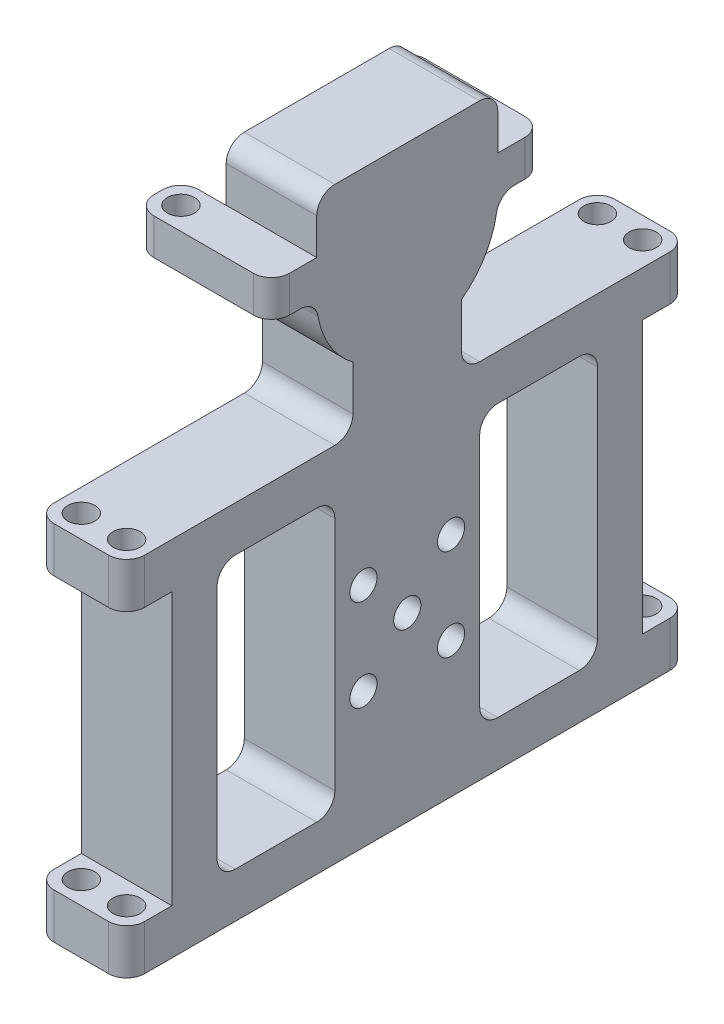
from build123d import *
from build123d.topology import SkipClean

# Parameters (mm, degrees)
SKETCH1_W            = 90
SKETCH1_H            = 20
BOSS_EXTRUDE1_DEPTH  = 20
SKETCH2_W            = 90
SKETCH2_H            = 3
CUT_EXTRUDE1_DEPTH   = 10
SKETCH3_W            = 3
SKETCH3_H            = 5
CUT_EXTRUDE2_DEPTH   = 10
SKETCH4_W            = 3
SKETCH4_H            = 1.75
SKETCH4_W_2          = 2.997618753
SKETCH4_W_3          = 3.002941468
CUT_EXTRUDE3_DEPTH   = 5
SKETCH5_W            = 1.5
SKETCH5_H            = 3
BOSS_EXTRUDE2_DEPTH  = 10
SKETCH6_W            = 1.5
SKETCH6_H            = 3
BOSS_EXTRUDE3_DEPTH  = 18
BOSS_EXTRUDE4_DEPTH  = 5
FILLET1_START        = 8.5
FILLET1_DEPTH        = 3
FILLET1_START_2      = 8
FILLET1_2_DEPTH      = 4
FILLET2_R            = 10
SKETCH8_W            = 20.140972823
SKETCH8_H            = 2
CUT_EXTRUDE4_DEPTH   = 119
FILLET3_R            = 2
SKETCH9_W            = 5
SKETCH9_H            = 4
BOSS_EXTRUDE6_DEPTH  = 5
SKETCH11_W           = 5
SKETCH11_H           = 4
BOSS_EXTRUDE7_DEPTH  = 5
SKETCH12_R           = 1.5
CUT_EXTRUDE5_DEPTH   = 24
FILLET4_R            = 2
SKETCH14_W           = 71.95999564
SKETCH14_H           = 44.647918029
CUT_EXTRUDE8_DEPTH   = 55
BOSS_EXTRUDE8_START  = 1.5
BOSS_EXTRUDE8_DEPTH  = 1.5
SKETCH16_W           = 5.976122604
SKETCH16_H           = 3
CUT_EXTRUDE9_DEPTH   = 10
SKETCH17_W           = 2
SKETCH17_H           = 3
BOSS_EXTRUDE9_DEPTH  = 10
BOSS_EXTRUDE10_DEPTH = 5
BOSS_EXTRUDE11_DEPTH = 10
SKETCH21_W           = 10
SKETCH21_H           = 4
BOSS_EXTRUDE21_DEPTH = 5
SKETCH22_R           = 1.5
CUT_EXTRUDE10_DEPTH  = 5
SKETCH23_W           = 10
SKETCH23_H           = 4
BOSS_EXTRUDE22_DEPTH = 5
SKETCH24_R           = 1.5
CUT_EXTRUDE11_DEPTH  = 5
SKETCH25_W           = 46.117576458
SKETCH25_H           = 7.536313902
CUT_EXTRUDE12_DEPTH  = 49
SKETCH26_W           = 45
SKETCH26_H           = 20
CUT_EXTRUDE13_DEPTH  = 49
SKETCH27_W           = 5
SKETCH27_H           = 4
BOSS_EXTRUDE23_DEPTH = 10
SKETCH28_R           = 1.5
CUT_EXTRUDE14_DEPTH  = 10
SKETCH29_W           = 5
SKETCH29_H           = 0.02
CUT_EXTRUDE15_DEPTH  = 10
FILLET8_R            = 2
SKETCH30_W           = 3
SKETCH30_H           = 12
CUT_EXTRUDE16_DEPTH  = 15
FILLET10_R           = 2
SKETCH32_R           = 1.5
CUT_EXTRUDE17_DEPTH  = 7.5
FILLET11_START       = -10
FILLET11_DEPTH       = 10
FILLET11_START_2     = -10.30822
FILLET11_2_DEPTH     = 10.61644
FILLET11_START_3     = -14.991159554
FILLET11_3_DEPTH     = 19.982319108
FILLET11_START_4     = -11.666666667
FILLET11_4_OUTLINE_R = 1.5
FILLET11_4_DEPTH     = 1.666666667
CUT_EXTRUDE19_DEPTH  = 32
SKETCH35_W           = 10
SKETCH35_H           = 12
BOSS_EXTRUDE24_DEPTH = 10
SKETCH36_W           = 10
SKETCH36_H           = 12
BOSS_EXTRUDE25_DEPTH = 16
SKETCH37_W           = 8.422588627
SKETCH37_H           = 30.638855418
CUT_EXTRUDE20_DEPTH  = 16
FILLET12_R           = 2
SKETCH38_W           = 10
SKETCH38_H           = 12
BOSS_EXTRUDE26_DEPTH = 47
SKETCH39_W           = 10
SKETCH39_H           = 5
BOSS_EXTRUDE27_DEPTH = 20
SKETCH41_W           = 5
SKETCH41_H           = 30.04
SKETCH41_W_2         = 15
SKETCH41_H_2         = 5
BOSS_EXTRUDE28_DEPTH = 10
SKETCH42_W           = 10
SKETCH42_H           = 5
BOSS_EXTRUDE29_DEPTH = 5
SKETCH43_W           = 10
SKETCH43_H           = 5
BOSS_EXTRUDE30_DEPTH = 5
SKETCH44_R           = 1.5
CUT_EXTRUDE21_DEPTH  = 48
FILLET13_R           = 2
SKETCH45_W           = 16
SKETCH45_H           = 30.04
BOSS_EXTRUDE31_DEPTH = 10
SKETCH46_R           = 1.5
CUT_EXTRUDE22_DEPTH  = 10
FILLET14_R           = 2


with BuildPart() as part:
    # Sketch1 → Boss-Extrude1 (new body)
    with BuildSketch(Plane.XY):
        with Locations((45, -10)):
            Rectangle(SKETCH1_W, SKETCH1_H)
    extrude(amount=BOSS_EXTRUDE1_DEPTH)

    # Sketch2 → Cut-Extrude1 (cut)
    with BuildSketch(Plane(origin=(0, 0, 0), x_dir=(1, 0, 0), z_dir=(0, 1, 0))):
        with Locations((45, -10)):
            Rectangle(SKETCH2_W, SKETCH2_H)
    extrude(amount=-CUT_EXTRUDE1_DEPTH, mode=Mode.SUBTRACT)

    # Sketch3 → Cut-Extrude2 (cut)
    with BuildSketch(Plane(origin=(0, 0, 0), x_dir=(1, 0, 0), z_dir=(0, 1, 0))):
        with Locations((11.25, -15.75)):
            Rectangle(SKETCH3_W, SKETCH3_H)
        with Locations((22.5, -15.75)):
            Rectangle(SKETCH3_W, SKETCH3_H)
        with Locations((33.75, -15.75)):
            Rectangle(SKETCH3_W, SKETCH3_H)
        with Locations((45, -15.75)):
            Rectangle(SKETCH3_W, SKETCH3_H)
        with Locations((56.25, -15.75)):
            Rectangle(SKETCH3_W, SKETCH3_H)
        with Locations((67.5, -15.75)):
            Rectangle(SKETCH3_W, SKETCH3_H)
        with Locations((78.75, -15.75)):
            Rectangle(SKETCH3_W, SKETCH3_H)
        with Locations((11.25, -4.25)):
            Rectangle(SKETCH3_W, SKETCH3_H)
        with Locations((22.5, -4.25)):
            Rectangle(SKETCH3_W, SKETCH3_H)
        with Locations((33.75, -4.25)):
            Rectangle(SKETCH3_W, SKETCH3_H)
        with Locations((45, -4.25)):
            Rectangle(SKETCH3_W, SKETCH3_H)
        with Locations((56.25, -4.25)):
            Rectangle(SKETCH3_W, SKETCH3_H)
        with Locations((67.5, -4.25)):
            Rectangle(SKETCH3_W, SKETCH3_H)
        with Locations((78.75, -4.25)):
            Rectangle(SKETCH3_W, SKETCH3_H)
    extrude(amount=-CUT_EXTRUDE2_DEPTH, mode=Mode.SUBTRACT)

    # Sketch4 → Cut-Extrude3 (cut)
    with BuildSketch(Plane(origin=(0, 0, 0), x_dir=(1, 0, 0), z_dir=(0, 1, 0))):
        with Locations((56.25, -19.125)):
            Rectangle(SKETCH4_W, SKETCH4_H)
        with Locations((67.5, -19.125)):
            Rectangle(SKETCH4_W, SKETCH4_H)
        Polygon((77.25, -18.25), (77.25, -20), (80.252941468, -20), (80.252941468, -18.25), (80.25, -18.25), align=None)
        with Locations((45, -19.125)):
            Rectangle(SKETCH4_W, SKETCH4_H)
        with Locations((33.748809377, -19.125)):
            Rectangle(SKETCH4_W_2, SKETCH4_H)
        with Locations((22.5, -19.125)):
            Rectangle(SKETCH4_W, SKETCH4_H)
        with Locations((11.25, -19.125)):
            Rectangle(SKETCH4_W, SKETCH4_H)
        with Locations((22.5, -0.875)):
            Rectangle(SKETCH4_W, SKETCH4_H)
        with Locations((33.748809377, -0.875)):
            Rectangle(SKETCH4_W_2, SKETCH4_H)
        with Locations((45, -0.875)):
            Rectangle(SKETCH4_W, SKETCH4_H)
        with Locations((56.25, -0.875)):
            Rectangle(SKETCH4_W, SKETCH4_H)
        with Locations((67.5, -0.875)):
            Rectangle(SKETCH4_W, SKETCH4_H)
        with Locations((78.751470734, -0.875)):
            Rectangle(SKETCH4_W_3, SKETCH4_H)
        with Locations((11.25, -0.875)):
            Rectangle(SKETCH4_W, SKETCH4_H)
    extrude(amount=-CUT_EXTRUDE3_DEPTH, mode=Mode.SUBTRACT)

    # Sketch5 → Boss-Extrude2 (add)
    with BuildSketch(Plane(origin=(0, -10, 0), x_dir=(1, 0, 0), z_dir=(0, 1, 0))):
        with Locations((0.75, -10)):
            Rectangle(SKETCH5_W, SKETCH5_H)
        with Locations((89.25, -10)):
            Rectangle(SKETCH5_W, SKETCH5_H)
    extrude(amount=BOSS_EXTRUDE2_DEPTH)

    # Sketch6 → Boss-Extrude3 (add)
    with BuildSketch(Plane(origin=(0, 0, 0), x_dir=(1, 0, 0), z_dir=(0, 1, 0))):
        with Locations((2.25, -10)):
            Rectangle(SKETCH6_W, SKETCH6_H)
        with Locations((87.75, -10)):
            Rectangle(SKETCH6_W, SKETCH6_H)
    extrude(amount=-BOSS_EXTRUDE3_DEPTH)

    # Sketch7 → Boss-Extrude4 (add)
    with BuildSketch(Plane.XY.offset(8.5)):
        Polygon((3, -9.907661673), (3, -10), (6, -10), (3, 0), align=None)
        Polygon((87, 0), (84, -10), (87, -10), align=None)
    extrude(amount=BOSS_EXTRUDE4_DEPTH)

    # Fillet1: read off the stored shape, not the designer's step
    # Fillet1 outline → Fillet1 (cut)
    with BuildSketch(Plane.XY.offset(FILLET1_START)):
        with BuildLine():
            ThreePointArc((1.511938698, 0), (2.705799758, -0.395414143), (3.427591269, -1.425304229))
            Line((3.427591269, -1.425304229), (3, 0))
            Line((3, 0), (1.511938698, 0))
        make_face()
        with BuildLine():
            Line((87, 0), (86.572408731, -1.425304229))
            ThreePointArc((86.572408731, -1.425304229), (87.294200242, -0.395414143), (88.488061302, 0))
            Line((88.488061302, 0), (87, 0))
        make_face()
    extrude(amount=FILLET1_DEPTH, mode=Mode.SUBTRACT)

    # Fillet1 2 outline → Fillet1 2 (add)
    with BuildSketch(Plane.XY.offset(FILLET1_START_2)):
        with BuildLine():
            Line((6, -10), (7.488061302, -10))
            ThreePointArc((7.488061302, -10), (6.294200242, -9.604585857), (5.572408731, -8.574695771))
            Line((5.572408731, -8.574695771), (6, -10))
        make_face()
        with BuildLine():
            ThreePointArc((84.427591269, -8.574695771), (83.705799758, -9.604585857), (82.511938698, -10))
            Line((82.511938698, -10), (84, -10))
            Line((84, -10), (84.427591269, -8.574695771))
        make_face()
    extrude(amount=FILLET1_2_DEPTH)

    # Fillet2
    fillet2_edges = [part.edges().sort_by_distance(p)[0] for p in [
        (45, -20, 0),
        (45, -20, 20),
    ]]
    fillet(fillet2_edges, radius=FILLET2_R - 0.0001)  # a hair under: the kernel refuses the full size

    # Sketch8 → Cut-Extrude4 (cut)
    with BuildSketch(Plane.ZY):
        with Locations((10.770725067, -19)):
            Rectangle(SKETCH8_W, SKETCH8_H)
    extrude(amount=-CUT_EXTRUDE4_DEPTH, mode=Mode.SUBTRACT)

    # Fillet3
    fillet3_edges = [part.edges().sort_by_distance(p)[0] for p in [
        (4.875, 0, 0),
        (4.875, 0, 20),
        (16.875, 0, 20),
        (16.875, 0, 0),
        (28.125, 0, 0),
        (28.125, 0, 20),
        (39.373809377, 0, 20),
        (39.373809377, 0, 0),
        (50.625, 0, 0),
        (50.625, 0, 20),
        (61.875, 0, 20),
        (61.875, 0, 0),
        (73.125, 0, 0),
        (73.125, 0, 20),
        (85.126470734, 0, 20),
        (85.126470734, 0, 0),
    ]]
    fillet(fillet3_edges, radius=FILLET3_R)

    # Sketch9 → Boss-Extrude6 (add)
    with BuildSketch(Plane.ZY):
        with Locations((-2.5, -4)):
            Rectangle(SKETCH9_W, SKETCH9_H)
        with Locations((22.5, -4)):
            Rectangle(SKETCH9_W, SKETCH9_H)
    extrude(amount=-BOSS_EXTRUDE6_DEPTH)

    # Sketch11 → Boss-Extrude7 (add)
    with BuildSketch(Plane(origin=(90, 0, 0), x_dir=(0, 0, -1), z_dir=(1, 0, 0))):
        with Locations((2.5, -4)):
            Rectangle(SKETCH11_W, SKETCH11_H)
        with Locations((-22.5, -4)):
            Rectangle(SKETCH11_W, SKETCH11_H)
    extrude(amount=-BOSS_EXTRUDE7_DEPTH)

    # Sketch12 → Cut-Extrude5 (cut)
    with BuildSketch(Plane(origin=(0, -2, 0), x_dir=(1, 0, 0), z_dir=(0, 1, 0))):
        with Locations(Location((2.5, 2.5, 0), (0, 0, 180))):
            Circle(SKETCH12_R)
        with Locations(Location((87.5, 2.5, 0), (0, 0, 180))):
            Circle(SKETCH12_R)
        with Locations(Location((87.5, -22.5, 0), (0, 0, 180))):
            Circle(SKETCH12_R)
        with Locations(Location((2.5, -22.5, 0), (0, 0, 180))):
            Circle(SKETCH12_R)
    extrude(amount=-CUT_EXTRUDE5_DEPTH, mode=Mode.SUBTRACT)

    # Fillet4
    fillet4_edges = [part.edges().sort_by_distance(p)[0] for p in [
        (0, -4, -5),
        (5, -4, -5),
        (5, -4, 25),
        (0, -4, 25),
        (85, -4, -5),
        (90, -4, -5),
        (85, -4, 25),
        (90, -4, 25),
    ]]
    fillet(fillet4_edges, radius=FILLET4_R)

    # Sketch14 → Cut-Extrude8 (cut)
    with BuildSketch(Plane(origin=(0, 0, 0), x_dir=(1, 0, 0), z_dir=(0, 1, 0))):
        with Locations((79.47999782, -11.65925291)):
            Rectangle(SKETCH14_W, SKETCH14_H)
    extrude(amount=-CUT_EXTRUDE8_DEPTH, mode=Mode.SUBTRACT)

    # Sketch15 → Boss-Extrude8 (add)
    with BuildSketch(Plane(origin=(43.5, 0, 0), x_dir=(0, 0, -1), z_dir=(1, 0, 0)).offset(BOSS_EXTRUDE8_START)):
        with BuildLine():
            Line((-11.5, 0), (-18, 0))
            ThreePointArc((-18, 0), (-19.414213562, -0.585786438), (-20, -2))
            Line((-20, -2), (-20, -10))
            ThreePointArc((-20, -10), (-18.94427191, -14.472135955), (-16, -18))
            Line((-16, -18), (-4, -18))
            ThreePointArc((-4, -18), (-1.05572809, -14.472135955), (0, -10))
            Line((0, -10), (0, -2))
            ThreePointArc((0, -2), (-0.585786438, -0.585786438), (-2, 0))
            Line((-2, 0), (-4, 0))
            Line((-4, 0), (-8.5, 0))
            Line((-8.5, 0), (-8.5, -10))
            Line((-8.5, -10), (-11.5, -10))
            Line((-11.5, -10), (-11.5, 0))
        make_face()
    extrude(amount=-BOSS_EXTRUDE8_DEPTH)

    # Sketch16 → Cut-Extrude9 (cut)
    with BuildSketch(Plane(origin=(0, 0, 0), x_dir=(1, 0, 0), z_dir=(0, 1, 0))):
        with Locations((4.5, -10)):
            Rectangle(SKETCH16_W, SKETCH16_H)
    extrude(amount=-CUT_EXTRUDE9_DEPTH, mode=Mode.SUBTRACT)

    # Sketch17 → Boss-Extrude9 (add)
    with BuildSketch(Plane(origin=(0, 0, 0), x_dir=(1, 0, 0), z_dir=(0, 1, 0))):
        Polygon((2, -8.5), (1.511938698, -8.5), (0, -8.5), (0, -11.5), (1.511938698, -11.5), (2, -11.5), align=None)
        with Locations((44, -10)):
            Rectangle(SKETCH17_W, SKETCH17_H)
    extrude(amount=-BOSS_EXTRUDE9_DEPTH)

    # Sketch18 → Boss-Extrude10 (add)
    with BuildSketch(Plane.XY.offset(8.5)):
        Polygon((4, -10), (2, 0), (2, -10), align=None)
        Polygon((43, 0), (41, -10), (43, -10), align=None)
    extrude(amount=BOSS_EXTRUDE10_DEPTH)

    # Sketch19 → Boss-Extrude11 (add)
    with BuildSketch(Plane.ZY):
        with BuildLine():
            ThreePointArc((2, 0), (0.585786438, -0.585786438), (0, -2))
            Line((0, -2), (0, -6))
            Line((0, -6), (0, -10))
            ThreePointArc((0, -10), (1.05572809, -14.472135955), (4, -18))
            Line((4, -18), (16, -18))
            ThreePointArc((16, -18), (18.94427191, -14.472135955), (20, -10))
            Line((20, -10), (20, -6))
            Line((20, -6), (20, -2))
            ThreePointArc((20, -2), (19.414213562, -0.585786438), (18, 0))
            Line((18, 0), (16, 0))
            Line((16, 0), (2, 0))
        make_face()
    extrude(amount=BOSS_EXTRUDE11_DEPTH)

    # Sketch21 → Boss-Extrude21 (add)
    with BuildSketch(Plane.XY.offset(20)):
        with Locations((0, -8)):
            Rectangle(SKETCH21_W, SKETCH21_H)
    extrude(amount=BOSS_EXTRUDE21_DEPTH)

    # Sketch22 → Cut-Extrude10 (cut)
    with BuildSketch(Plane(origin=(0, -6, 0), x_dir=(1, 0, 0), z_dir=(0, 1, 0))):
        with Locations(Location((2.5, -22.5, 0), (0, 0, 180))):
            Circle(SKETCH22_R)
    extrude(amount=-CUT_EXTRUDE10_DEPTH, mode=Mode.SUBTRACT)

    # Sketch23 → Boss-Extrude22 (add)
    with BuildSketch(Plane(origin=(0, 0, 0), x_dir=(-1, 0, 0), z_dir=(0, 0, -1))):
        with Locations((0, -8)):
            Rectangle(SKETCH23_W, SKETCH23_H)
    extrude(amount=BOSS_EXTRUDE22_DEPTH)

    # Sketch24 → Cut-Extrude11 (cut)
    with BuildSketch(Plane(origin=(0, -6, 0), x_dir=(1, 0, 0), z_dir=(0, 1, 0))):
        with Locations(Location((2.5, 2.5, 0), (0, 0, 180))):
            Circle(SKETCH24_R)
    extrude(amount=-CUT_EXTRUDE11_DEPTH, mode=Mode.SUBTRACT)

    # Sketch25 → Cut-Extrude12 (cut)
    with BuildSketch(Plane.XY.offset(25)):
        with Locations((23.058788229, -2.231843049)):
            Rectangle(SKETCH25_W, SKETCH25_H)
    extrude(amount=-CUT_EXTRUDE12_DEPTH, mode=Mode.SUBTRACT)

    # Sketch26 → Cut-Extrude13 (cut)
    with BuildSketch(Plane(origin=(0, -6, 0), x_dir=(1, 0, 0), z_dir=(0, 1, 0))):
        with Locations((22.5, -10)):
            Rectangle(SKETCH26_W, SKETCH26_H)
    extrude(amount=-CUT_EXTRUDE13_DEPTH, mode=Mode.SUBTRACT)

    # Sketch27 → Boss-Extrude23 (add)
    with BuildSketch(Plane.ZY.offset(5)):
        with Locations((-2.5, -8)):
            Rectangle(SKETCH27_W, SKETCH27_H)
        with Locations((22.5, -8)):
            Rectangle(SKETCH27_W, SKETCH27_H)
    extrude(amount=BOSS_EXTRUDE23_DEPTH)

    # Sketch28 → Cut-Extrude14 (cut)
    with BuildSketch(Plane(origin=(0, -6, 0), x_dir=(1, 0, 0), z_dir=(0, 1, 0))):
        with Locations(Location((-12.5, 2.5, 0), (0, 0, 270))):
            Circle(SKETCH28_R)
        with Locations(Location((-12.5, -22.5, 0), (0, 0, 270))):
            Circle(SKETCH28_R)
    extrude(amount=-CUT_EXTRUDE14_DEPTH, mode=Mode.SUBTRACT)

    # Sketch29 → Cut-Extrude15 (cut)
    with BuildSketch(Plane(origin=(0, -6, 0), x_dir=(1, 0, 0), z_dir=(0, 1, 0))):
        with Locations((-12.5, 0.01)):
            Rectangle(SKETCH29_W, SKETCH29_H)
        with Locations((2.5, 0.01)):
            Rectangle(SKETCH29_W, SKETCH29_H)
        with Locations((-12.5, -20.01)):
            Rectangle(SKETCH29_W, SKETCH29_H)
        with Locations((2.5, -20.01)):
            Rectangle(SKETCH29_W, SKETCH29_H)
    extrude(amount=-CUT_EXTRUDE15_DEPTH, mode=Mode.SUBTRACT)

    # Fillet8
    fillet8_edges = [part.edges().sort_by_distance(p)[0] for p in [
        (5, -8, 25),
        (5, -8, -5),
        (-15, -8, -5),
        (-15, -8, 25),
        (-15, -8, 20.02),
        (-15, -8, -0.02),
        (5, -8, -0.02),
        (5, -8, 20.02),
    ]]
    fillet(fillet8_edges, radius=FILLET8_R)

    # Sketch30 → Cut-Extrude16 (cut)
    with BuildSketch(Plane.XZ.offset(18)):
        with Locations((-5, 10)):
            Rectangle(SKETCH30_W, SKETCH30_H)
    extrude(amount=-CUT_EXTRUDE16_DEPTH, mode=Mode.SUBTRACT)

    # Fillet10
    fillet10_edges = [part.edges().sort_by_distance(p)[0] for p in [
        (-5, -3, 4),
        (-5, -3, 16),
    ]]
    fillet(fillet10_edges, radius=FILLET10_R)

    # Sketch32 → Cut-Extrude17 (cut, symmetric)
    with BuildSketch(Plane(origin=(-6.5, 0, 0), x_dir=(0, 0, -1), z_dir=(1, 0, 0))):
        with Locations(Location((-7, -10.5, 0), (0, 0, 270))):
            Circle(SKETCH32_R)
        with Locations(Location((-13, -10.5, 0), (0, 0, 270))):
            Circle(SKETCH32_R)
    extrude(amount=CUT_EXTRUDE17_DEPTH, both=True, mode=Mode.SUBTRACT)

    # Fillet11: read off the stored shape, not the designer's step
    # Fillet11 outline → Fillet11 (add)
    with BuildSketch(Plane.YZ.offset(FILLET11_START)):
        with BuildLine():
            Line((-10, 20), (-10, 21.832159566))
            ThreePointArc((-10, 21.832159566), (-10.472474768, 20.541165117), (-11.666666667, 19.860132972))
            ThreePointArc((-11.666666667, 19.860132972), (-10.836262603, 19.964971895), (-10, 20))
        make_face()
        with BuildLine():
            ThreePointArc((-11.666666667, 0.139867028), (-10.472474768, -0.541165117), (-10, -1.832159566))
            Line((-10, -1.832159566), (-10, 0))
            ThreePointArc((-10, 0), (-10.836262603, 0.035028105), (-11.666666667, 0.139867028))
        make_face()
    extrude(amount=FILLET11_DEPTH)

    # Fillet11 2 outline → Fillet11 2 (add)
    with BuildSketch(Plane.YZ.offset(FILLET11_START_2)):
        with BuildLine():
            Line((-11.153786252, 20.02), (-10, 20.02))
            Line((-10, 20.02), (-10, 21.832159566))
            ThreePointArc((-10, 21.832159566), (-10.312927462, 20.758015138), (-11.153786252, 20.02))
        make_face()
        with BuildLine():
            Line((-10, -0.02), (-11.153786252, -0.02))
            ThreePointArc((-11.153786252, -0.02), (-10.312927462, -0.758015138), (-10, -1.832159566))
            Line((-10, -1.832159566), (-10, -0.02))
        make_face()
    extrude(amount=FILLET11_2_DEPTH)

    # Fillet11 3 outline → Fillet11 3 (add)
    with BuildSketch(Plane.YZ.offset(FILLET11_START_3)):
        with BuildLine():
            Line((-11.153786252, 20.02), (-10, 20.02))
            Line((-10, 20.02), (-10, 21.832159566))
            ThreePointArc((-10, 21.832159566), (-10.312927462, 20.758015138), (-11.153786252, 20.02))
        make_face()
        with BuildLine():
            Line((-10, -0.02), (-11.153786252, -0.02))
            ThreePointArc((-11.153786252, -0.02), (-10.312927462, -0.758015138), (-10, -1.832159566))
            Line((-10, -1.832159566), (-10, -0.02))
        make_face()
    extrude(amount=FILLET11_3_DEPTH)

    # Fillet11 4 outline → Fillet11 4 (cut)
    with SkipClean():  # the faces are left unmerged after this step: merging them gives an invalid solid
        with BuildSketch(Plane(origin=(0, 0, 0), x_dir=(1, 0, 0), z_dir=(0, 1, 0)).offset(FILLET11_START_4)):
            with BuildLine():
                Line((-14.991159554, -20.02), (-14.991159455, -21.832159575))
                ThreePointArc((-14.991159455, -21.832159575), (-14.346164765, -20.540864975), (-13, -20.02))
                Line((-13, -20.02), (-14.991159554, -20.02))
            make_face()
            with BuildLine():
                ThreePointArc((-13, 0.02), (-14.346164765, 0.540864975), (-14.991159455, 1.832159575))
                Line((-14.991159455, 1.832159575), (-14.991159554, 0.02))
                Line((-14.991159554, 0.02), (-13, 0.02))
            make_face()
            with BuildLine():
                ThreePointArc((4.991159455, 1.832159575), (4.346164765, 0.540864975), (3, 0.02))
                Line((3, 0.02), (4.991159554, 0.02))
                Line((4.991159554, 0.02), (4.991159455, 1.832159575))
            make_face()
            with BuildLine():
                ThreePointArc((3, -20.02), (4.346164765, -20.540864975), (4.991159455, -21.832159575))
                Line((4.991159455, -21.832159575), (4.991159554, -20.02))
                Line((4.991159554, -20.02), (3, -20.02))
            make_face()
            with Locations((2.5, 2.5)):
                Circle(FILLET11_4_OUTLINE_R)
            with Locations((2.5, -22.5)):
                Circle(FILLET11_4_OUTLINE_R)
            with Locations((-12.5, -22.5)):
                Circle(FILLET11_4_OUTLINE_R)
            with Locations((-12.5, 2.5)):
                Circle(FILLET11_4_OUTLINE_R)
        extrude(amount=FILLET11_4_DEPTH, mode=Mode.SUBTRACT)

    # Sketch34 → Cut-Extrude19 (cut)
    with BuildSketch(Plane.XY.offset(25)):
        Polygon((5, -18), (5, -11.347298632), (5, -10), (3, -10), (0, -10), (0, -11.347298632), (0, -18), align=None)
        Polygon((-10, -18), (-10, -11.347298632), (-10, -10), (-13, -10), (-15, -10), (-15, -11.347298632), (-15, -18), align=None)
    extrude(amount=-CUT_EXTRUDE19_DEPTH, mode=Mode.SUBTRACT)

    # Sketch35 → Boss-Extrude24 (add)
    with BuildSketch(Plane(origin=(0, -18, 0), x_dir=(-1, 0, 0), z_dir=(0, -1, 0))):
        with Locations((5, -10)):
            Rectangle(SKETCH35_W, SKETCH35_H)
    extrude(amount=-BOSS_EXTRUDE24_DEPTH)

    # Sketch36 → Boss-Extrude25 (add)
    with BuildSketch(Plane.XZ.offset(18)):
        with Locations((-5, 10)):
            Rectangle(SKETCH36_W, SKETCH36_H)
    extrude(amount=-BOSS_EXTRUDE25_DEPTH)

    # Sketch37 → Cut-Extrude20 (cut)
    with BuildSketch(Plane(origin=(0, -6, 0), x_dir=(1, 0, 0), z_dir=(0, 1, 0))):
        with Locations((4.211294313, -9.680572291)):
            Rectangle(SKETCH37_W, SKETCH37_H)
    extrude(amount=-CUT_EXTRUDE20_DEPTH, mode=Mode.SUBTRACT)

    # Fillet12
    fillet12_edges = [part.edges().sort_by_distance(p)[0] for p in [
        (0, -8, -5),
        (0, -8, 25),
    ]]
    fillet(fillet12_edges, radius=FILLET12_R)

    # Sketch38 → Boss-Extrude26 (add)
    with BuildSketch(Plane.XZ.offset(18)):
        with Locations((-5, 10)):
            Rectangle(SKETCH38_W, SKETCH38_H)
    extrude(amount=BOSS_EXTRUDE26_DEPTH)

    # Sketch39 → Boss-Extrude27 (add)
    with BuildSketch(Plane(origin=(0, 0, 4), x_dir=(-1, 0, 0), z_dir=(0, 0, -1))):
        with Locations((5, -27.46)):
            Rectangle(SKETCH39_W, SKETCH39_H)
        with Locations((5, -62.5)):
            Rectangle(SKETCH39_W, SKETCH39_H)
    extrude(amount=BOSS_EXTRUDE27_DEPTH)

    # Sketch41 → Boss-Extrude28 (add)
    with BuildSketch(Plane(origin=(0, 0, 0), x_dir=(0, 0, -1), z_dir=(1, 0, 0))):
        with Locations((13.5, -44.98)):
            Rectangle(SKETCH41_W, SKETCH41_H)
        with Locations((-23.5, -27.46)):
            Rectangle(SKETCH41_W_2, SKETCH41_H_2)
        Polygon((-31, -29.96), (-31, -24.96), (-36, -24.96), (-36, -65), (-31, -65), (-31, -60), align=None)
        with Locations((-23.5, -62.5)):
            Rectangle(SKETCH41_W_2, SKETCH41_H_2)
    extrude(amount=-BOSS_EXTRUDE28_DEPTH)

    # Sketch42 → Boss-Extrude29 (add)
    with BuildSketch(Plane(origin=(0, 0, -16), x_dir=(-1, 0, 0), z_dir=(0, 0, -1))):
        with Locations((5, -27.46)):
            Rectangle(SKETCH42_W, SKETCH42_H)
        with Locations((5, -62.5)):
            Rectangle(SKETCH42_W, SKETCH42_H)
    extrude(amount=BOSS_EXTRUDE29_DEPTH)

    # Sketch43 → Boss-Extrude30 (add)
    with BuildSketch(Plane.XY.offset(36)):
        with Locations((-5, -27.46)):
            Rectangle(SKETCH43_W, SKETCH43_H)
        with Locations((-5, -62.5)):
            Rectangle(SKETCH43_W, SKETCH43_H)
    extrude(amount=BOSS_EXTRUDE30_DEPTH)

    # Sketch44 → Cut-Extrude21 (cut)
    with BuildSketch(Plane.XZ.offset(65)):
        with Locations(Location((-7.5, 38.5, 0), (0, 0, 270))):
            Circle(SKETCH44_R)
        with Locations(Location((-2.5, 38.5, 0), (0, 0, 270))):
            Circle(SKETCH44_R)
        with Locations(Location((-7.65412453, -18.65412453, 0), (0, 0, 270))):
            Circle(SKETCH44_R)
        with Locations(Location((-2.65412453, -18.65412453, 0), (0, 0, 270))):
            Circle(SKETCH44_R)
    extrude(amount=-CUT_EXTRUDE21_DEPTH, mode=Mode.SUBTRACT)

    # Fillet13
    fillet13_edges = [part.edges().sort_by_distance(p)[0] for p in [
        (-5, -24.96, 4),
        (-5, -60, -11),
        (-5, -29.96, -11),
        (-5, -24.96, 16),
        (-5, -29.96, 31),
        (-5, -60, 31),
        (0, -27.46, -21),
        (-10, -27.46, -21),
        (0, -62.5, -21),
        (-10, -62.5, -21),
        (-10, -27.46, 41),
        (0, -27.46, 41),
        (-10, -62.5, 41),
        (0, -62.5, 41),
    ]]
    fillet(fillet13_edges, radius=FILLET13_R)

    # Sketch45 → Boss-Extrude31 (add)
    with BuildSketch(Plane.ZY.offset(10)):
        with Locations((10, -44.98)):
            Rectangle(SKETCH45_W, SKETCH45_H)
    extrude(amount=-BOSS_EXTRUDE31_DEPTH)

    # Sketch46 → Cut-Extrude22 (cut)
    with BuildSketch(Plane.ZY.offset(10)):
        with Locations(Location((14.837842206, -39.906994698, 0), (0, 0, 270))):
            Circle(SKETCH46_R)
        with Locations(Location((14.837842206, -50.053005302, 0), (0, 0, 270))):
            Circle(SKETCH46_R)
        with Locations(Location((5.162157794, -39.906994698, 0), (0, 0, 270))):
            Circle(SKETCH46_R)
        with Locations(Location((5.162157794, -50.053005302, 0), (0, 0, 270))):
            Circle(SKETCH46_R)
        with Locations(Location((10, -44.98, 0), (0, 0, 270))):
            Circle(SKETCH46_R)
    extrude(amount=-CUT_EXTRUDE22_DEPTH, mode=Mode.SUBTRACT)

    # Fillet14
    fillet14_edges = [part.edges().sort_by_distance(p)[0] for p in [
        (-5, -60, 18),
        (-5, -29.96, 2),
        (-5, -29.96, 18),
        (-5, -60, 2),
    ]]
    fillet(fillet14_edges, radius=FILLET14_R)


solid = part.part
